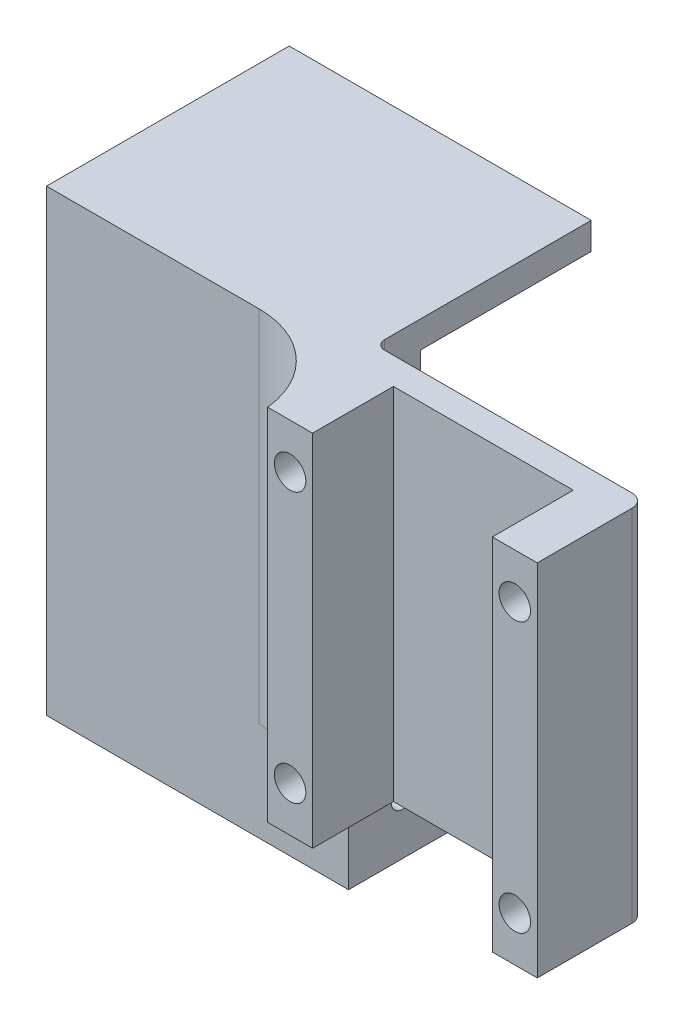
from build123d import *

# Parameters (mm, degrees)
BOSS_EXTRU_1_DEPTH      = 3
ESQUISSE3_W             = 33.6
ESQUISSE3_H             = 3
BOSS_EXTRU_2_DEPTH      = 24
ESQUISSE4_W             = 5
ESQUISSE4_H             = 5
ESQUISSE4_R             = 1.25
BOSS_EXTRU_3_DEPTH      = 2.8
BOSS_EXTRU_4_START      = -2.8
ESQUISSE5_W             = 5
ESQUISSE5_H             = 5
ESQUISSE5_R             = 1.25
BOSS_EXTRU_4_DEPTH      = 2.8
ESQUISSE4_2_W           = 5
ESQUISSE4_2_H           = 5
ESQUISSE4_2_R           = 1.25
BOSS_EXTRU_5_DEPTH      = 4.8
ESQUISSE6_W             = 5
ESQUISSE6_H             = 40
ESQUISSE6_R             = 1.75
BOSS_EXTRU_6_DEPTH      = 9
CONG_3_R                = 10
CONG_4_R                = 1
CONG_1_R                = 1.45
CONG_2_R                = 1
ENL_V_MAT_EXTRU_1_REACH = 65.655
ESQUISSE6_3_R           = 1.75


with BuildPart() as part:
    # Esquisse1 → Boss.-Extru.1 (new body)
    with BuildSketch(Plane.XY):
        Polygon((-15, -20), (15, -20), (15, 20), (-15, 20), (-48.6, 20), (-48.6, -31), (-15, -31), align=None)
    extrude(amount=BOSS_EXTRU_1_DEPTH)

    # Esquisse3 → Boss.-Extru.2 (add)
    with BuildSketch(Plane(origin=(0, 0, 0), x_dir=(-1, 0, 0), z_dir=(0, 0, -1))):
        with Locations((31.8, -29.5)):
            Rectangle(ESQUISSE3_W, ESQUISSE3_H)
        with Locations((31.8, 18.5)):
            Rectangle(ESQUISSE3_W, ESQUISSE3_H)
    extrude(amount=BOSS_EXTRU_2_DEPTH)

    # Esquisse4 → Boss.-Extru.3 (add)
    # profile 1 of 4: a face of its own
    with BuildSketch(Plane.ZY.offset(48.6)):
        with Locations((-21.5, -25.5)):
            Rectangle(ESQUISSE4_W, ESQUISSE4_H)
        with Locations(Location((-21, -25, 0), (0, 0, 270))):
            Circle(ESQUISSE4_R, mode=Mode.SUBTRACT)
    # profile 2 of 4: a face of its own
    with BuildSketch(Plane.ZY.offset(48.6)):
        with Locations((-2.5, -25.5)):
            Rectangle(ESQUISSE4_W, ESQUISSE4_H)
        with Locations(Location((-3, -25, 0), (0, 0, 90))):
            Circle(ESQUISSE4_R, mode=Mode.SUBTRACT)
    # profile 3 of 4: a face of its own
    with BuildSketch(Plane.ZY.offset(48.6)):
        with Locations((-2.5, 14.5)):
            Rectangle(ESQUISSE4_W, ESQUISSE4_H)
        with Locations(Location((-3, 14, 0), (0, 0, 270))):
            Circle(ESQUISSE4_R, mode=Mode.SUBTRACT)
    # profile 4 of 4: a face of its own
    with BuildSketch(Plane.ZY.offset(48.6)):
        with Locations((-21.5, 14.5)):
            Rectangle(ESQUISSE4_W, ESQUISSE4_H)
        with Locations(Location((-21, 14, 0), (0, 0, 90))):
            Circle(ESQUISSE4_R, mode=Mode.SUBTRACT)
    extrude(amount=-BOSS_EXTRU_3_DEPTH)

    # Esquisse5 → Boss.-Extru.4 (add)
    # profile 1 of 3: a face of its own
    with BuildSketch(Plane(origin=(-15, 0, 0), x_dir=(0, 0, -1), z_dir=(1, 0, 0)).offset(BOSS_EXTRU_4_START)):
        with Locations((2.5, -25.5)):
            Rectangle(ESQUISSE5_W, ESQUISSE5_H)
        with Locations(Location((3, -25, 0), (0, 0, 90))):
            Circle(ESQUISSE5_R, mode=Mode.SUBTRACT)
    # profile 2 of 3: a face of its own
    with BuildSketch(Plane(origin=(-15, 0, 0), x_dir=(0, 0, -1), z_dir=(1, 0, 0)).offset(BOSS_EXTRU_4_START)):
        with Locations((2.5, 14.5)):
            Rectangle(ESQUISSE5_W, ESQUISSE5_H)
        with Locations(Location((3, 14, 0), (0, 0, 270))):
            Circle(ESQUISSE5_R, mode=Mode.SUBTRACT)
    # profile 3 of 3: a face of its own
    with BuildSketch(Plane(origin=(-15, 0, 0), x_dir=(0, 0, -1), z_dir=(1, 0, 0)).offset(BOSS_EXTRU_4_START)):
        with Locations((2.5, 3.3)):
            Rectangle(ESQUISSE5_W, ESQUISSE5_H)
        with Locations((3, 3.3)):
            Circle(ESQUISSE5_R, mode=Mode.SUBTRACT)
    extrude(amount=BOSS_EXTRU_4_DEPTH)

    # Esquisse4<2> → Boss.-Extru.5 (add)
    # profile 1 of 2: a face of its own
    with BuildSketch(Plane.ZY.offset(48.6)):
        with Locations((-21.5, -25.5)):
            Rectangle(ESQUISSE4_2_W, ESQUISSE4_2_H)
        with Locations(Location((-21, -25, 0), (0, 0, 270))):
            Circle(ESQUISSE4_2_R, mode=Mode.SUBTRACT)
    # profile 2 of 2: a face of its own
    with BuildSketch(Plane.ZY.offset(48.6)):
        with Locations((-2.5, -25.5)):
            Rectangle(ESQUISSE4_2_W, ESQUISSE4_2_H)
        with Locations(Location((-3, -25, 0), (0, 0, 270))):
            Circle(ESQUISSE4_2_R, mode=Mode.SUBTRACT)
    extrude(amount=-BOSS_EXTRU_5_DEPTH)

    # Esquisse6 → Boss.-Extru.6 (add)
    # profile 1 of 2: a face of its own
    with BuildSketch(Plane.XY.offset(3)):
        with Locations((12.5, 0)):
            Rectangle(ESQUISSE6_W, ESQUISSE6_H)
        with Locations(Location((12.5, -15, 0), (0, 0, 180))):
            Circle(ESQUISSE6_R, mode=Mode.SUBTRACT)
        with Locations((12.5, 15)):
            Circle(ESQUISSE6_R, mode=Mode.SUBTRACT)
    # profile 2 of 2: a face of its own
    with BuildSketch(Plane.XY.offset(3)):
        with Locations((-12.5, 0)):
            Rectangle(ESQUISSE6_W, ESQUISSE6_H)
        with Locations((-12.5, -15)):
            Circle(ESQUISSE6_R, mode=Mode.SUBTRACT)
        with Locations((-12.5, 15)):
            Circle(ESQUISSE6_R, mode=Mode.SUBTRACT)
    extrude(amount=BOSS_EXTRU_6_DEPTH)

    # Congé3
    # the kernel refuses this fillet: 10 mm, written as the material it adds along each edge
    with BuildSketch(Plane(origin=(-15, 20, 3), x_dir=(-1, 0, 0), z_dir=(0, -1, 0))) as cong_3_piece_1:
        with BuildLine():
            CenterArc((9.949874371, -10), CONG_3_R, 90, 84.260829523)
            Line((0, -9), (0, 0))
            Line((0, 0), (9.949874371, 0))
        make_face()
    extrude(amount=40)

    # Congé4
    # the kernel refuses this fillet: 1 mm, written as the material it adds along each edge
    with BuildSketch(Plane(origin=(-15, -20, 0), x_dir=(1, 0, 0), z_dir=(0, 0, 1))) as cong_4_piece_1:
        with BuildLine():
            CenterArc((CONG_4_R, -CONG_4_R), CONG_4_R, 90, 90)
            Line((0, -CONG_4_R), (0, 0))
            Line((0, 0), (CONG_4_R, 0))
        make_face()
    extrude(amount=3)
    with BuildSketch(Plane(origin=(-15, 0.8, 0), x_dir=(1, 0, 0), z_dir=(0, 1, 0))) as cong_4_piece_2:
        with BuildLine():
            CenterArc((CONG_4_R, CONG_4_R), CONG_4_R, 180, 90)
            Line((0, CONG_4_R), (0, 0))
            Line((0, 0), (CONG_4_R, 0))
        make_face()
    extrude(amount=5)
    with BuildSketch(Plane(origin=(-15, 12, 0), x_dir=(1, 0, 0), z_dir=(0, 1, 0))) as cong_4_piece_3:
        with BuildLine():
            CenterArc((CONG_4_R, CONG_4_R), CONG_4_R, 180, 90)
            Line((0, CONG_4_R), (0, 0))
            Line((0, 0), (CONG_4_R, 0))
        make_face()
    extrude(amount=8)

    # Congé1
    cong_1_edges = [part.edges().sort_by_distance(p)[0] for p in [
        (-16.4, 12, -5),
        (-16.4, 5.8, -5),
        (-16.4, 0.8, -5),
        (-16.4, -23, -5),
        (-16.4, -28, -5),
        (-46.2, -23, -19),
        (-46.2, -28, -19),
        (-46.2, -28, -5),
        (-46.2, -23, -5),
        (-47.2, 12, -5),
        (15, 0, 0),
        (-47.2, 12, -19),
    ]]
    fillet(cong_1_edges, radius=CONG_1_R)

    # Congé2
    cong_2_edges = [part.edges().sort_by_distance(p)[0] for p in [
        (-47.2, 12, -24),
        (-16.4, -23, 0),
        (-15.9, 12, 0),
        (-15.9, 0.8, 0),
        (-15.9, 5.8, 0),
        (-46.2, -23, -24),
    ]]
    fillet(cong_2_edges, radius=CONG_2_R)

    # Esquisse6<3> → Enlèv. mat.-Extru.1 (cut, up to next)
    with BuildSketch(Plane.XY.offset(3), mode=Mode.PRIVATE) as enl_v_mat_extru_1_sk1:
        with Locations(Location((-12.5, 15, 0), (0, 0, 211.002719134))):
            Circle(ESQUISSE6_3_R)
    enl_v_mat_extru_1_tool1 = extrude(enl_v_mat_extru_1_sk1.sketch, amount=-ENL_V_MAT_EXTRU_1_REACH, mode=Mode.PRIVATE) & part.part
    # Esquisse6<3> → Enlèv. mat.-Extru.1 (cut, up to next)
    with BuildSketch(Plane.XY.offset(3), mode=Mode.PRIVATE) as enl_v_mat_extru_1_sk2:
        with Locations(Location((-12.5, -15, 0), (0, 0, 180))):
            Circle(ESQUISSE6_3_R)
    enl_v_mat_extru_1_tool2 = extrude(enl_v_mat_extru_1_sk2.sketch, amount=-ENL_V_MAT_EXTRU_1_REACH, mode=Mode.PRIVATE) & part.part
    # Esquisse6<3> → Enlèv. mat.-Extru.1 (cut, up to next)
    with BuildSketch(Plane.XY.offset(3), mode=Mode.PRIVATE) as enl_v_mat_extru_1_sk3:
        with Locations(Location((12.5, -15, 0), (0, 0, 53.130102354))):
            Circle(ESQUISSE6_3_R)
    enl_v_mat_extru_1_tool3 = extrude(enl_v_mat_extru_1_sk3.sketch, amount=-ENL_V_MAT_EXTRU_1_REACH, mode=Mode.PRIVATE) & part.part
    # Esquisse6<3> → Enlèv. mat.-Extru.1 (cut, up to next)
    with BuildSketch(Plane.XY.offset(3), mode=Mode.PRIVATE) as enl_v_mat_extru_1_sk4:
        with Locations(Location((12.5, 15, 0), (0, 0, 306.869897646))):
            Circle(ESQUISSE6_3_R)
    enl_v_mat_extru_1_tool4 = extrude(enl_v_mat_extru_1_sk4.sketch, amount=-ENL_V_MAT_EXTRU_1_REACH, mode=Mode.PRIVATE) & part.part
    add(enl_v_mat_extru_1_tool1.solids().sort_by_distance((-12.5, 15, 3))[0], mode=Mode.SUBTRACT)
    add(enl_v_mat_extru_1_tool2.solids().sort_by_distance((-12.5, -15, 3))[0], mode=Mode.SUBTRACT)
    add(enl_v_mat_extru_1_tool3.solids().sort_by_distance((12.5, -15, 3))[0], mode=Mode.SUBTRACT)
    add(enl_v_mat_extru_1_tool4.solids().sort_by_distance((12.5, 15, 3))[0], mode=Mode.SUBTRACT)


solid = part.part
